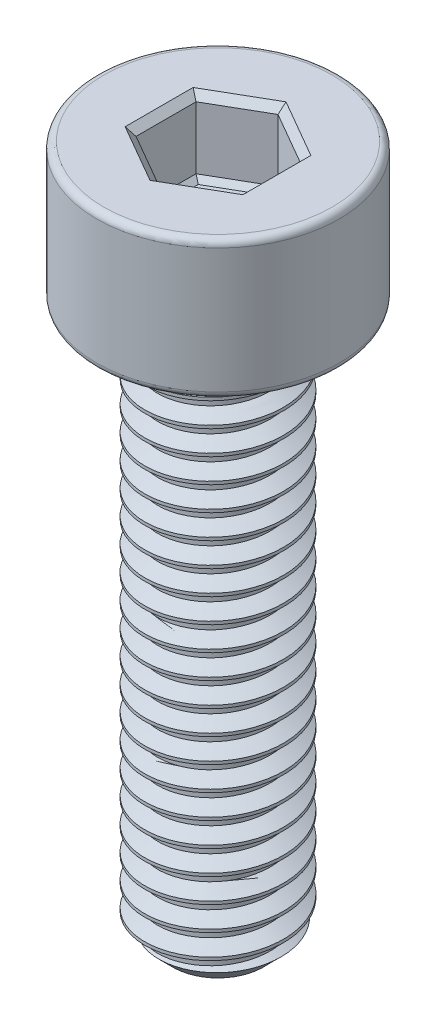
from build123d import *

# Parameters (mm, degrees)
SKETCH1_R           = 2
BOSS_EXTRUDE1_DEPTH = 16
THREAD1_PITCH       = 0.7
SKETCH4_R           = 3.5
BOSS_EXTRUDE2_DEPTH = 4
FILLET1_R           = 0.2
CUT_EXTRUDE1_DEPTH  = 2
CHAMFER1_SIZE       = 0.2
CUT_EXTRUDE2_DEPTH  = 0.15
CUT_EXTRUDE2_DRAFT  = -45


with BuildPart() as part:
    # Sketch1 → Boss-Extrude1 (new body)
    with BuildSketch(Plane(origin=(0, 0, 0), x_dir=(1, 0, 0), z_dir=(0, 1, 0))):
        with Locations(Location((0, 0, 0), (0, 0, 270))):
            Circle(SKETCH1_R)
    extrude(amount=BOSS_EXTRUDE1_DEPTH)

    # Thread1: arcs per turn and ends read off the stored shape
    # Thread1: the profile of Thread Profile1 profile screwed along a right-hand helix through 25.714289 turns, 6 arcs to a turn; built about Z, then put on its axis
    thread1_z = Axis((0, 0, 0), (0, 0, 1))
    thread1_corners = [(2.0003, 0, -0.000173205), (2.0003, 0, 0.612673203), (1.621113887, 0, 0.393749999), (1.621113887, 0, 0.218749999)]
    with BuildLine(mode=Mode.PRIVATE) as thread1_profile:
        Line(thread1_corners[0], thread1_corners[1])
        Line(thread1_corners[1], thread1_corners[2])
        Line(thread1_corners[2], thread1_corners[3])
        Line(thread1_corners[3], thread1_corners[0])
    thread1_cap = Face(thread1_profile.wire())
    thread1_turn_angles = [0, 30, 60, 90, 120, 150, 180, 210, 240, 270, 300, 330, 360]
    thread1_turn_weights = [1, 0.8660254037844387, 1, 0.8660254037844387, 1, 0.8660254037844387, 1, 0.8660254037844387, 1, 0.8660254037844387, 1, 0.8660254037844387, 1]
    thread1_turn_rails = [Edge.make_bspline([Vector(p[0], p[1], 0).rotate(thread1_z, thread1_turn_angles[k]) / thread1_turn_weights[k] + Vector(0, 0, p[2] + THREAD1_PITCH * thread1_turn_angles[k] / 360) for k in range(13)], [0, 0, 0, 1, 1, 2, 2, 3, 3, 4, 4, 5, 5, 6, 6, 6], 2, thread1_turn_weights) for p in thread1_corners]
    thread1_turn_sides = [Face.make_surface_from_curves(thread1_turn_rails[p[0]], thread1_turn_rails[p[1]]) for p in [(0, 1), (1, 2), (2, 3), (3, 0)]]
    thread1_last_angles = [9000, 9030, 9060, 9090, 9120, 9150, 9180, 9210, 9240, 9248.572, 9257.144]
    thread1_last_weights = [1, 0.8660254037844387, 1, 0.8660254037844387, 1, 0.8660254037844387, 1, 0.8660254037844387, 1, 0.9888293397312249, 1]
    thread1_last_rails = [Edge.make_bspline([Vector(p[0], p[1], 0).rotate(thread1_z, thread1_last_angles[k]) / thread1_last_weights[k] + Vector(0, 0, p[2] + THREAD1_PITCH * thread1_last_angles[k] / 360) for k in range(11)], [0, 0, 0, 1, 1, 2, 2, 3, 3, 4, 4, 5, 5, 5], 2, thread1_last_weights) for p in thread1_corners]
    thread1_last_sides = [Face.make_surface_from_curves(thread1_last_rails[p[0]], thread1_last_rails[p[1]]) for p in [(0, 1), (1, 2), (2, 3), (3, 0)]]
    thread1 = Plane(origin=(0, -1, 0), x_dir=(1, 0, 0), z_dir=(0, 1, 0)) * Solid(Shell([*[p.moved(Location((0, 0, THREAD1_PITCH * i))) for i in range(25) for p in thread1_turn_sides], *thread1_last_sides, thread1_cap, thread1_cap.rotate(thread1_z, 9257.144).moved(Location((0, 0, THREAD1_PITCH * 9257.144 / 360)))]))
    add(thread1, mode=Mode.SUBTRACT)

    # Sketch4 → Boss-Extrude2 (add)
    with BuildSketch(Plane(origin=(0, 16, 0), x_dir=(-1, 0, 0), z_dir=(0, -1, 0))):
        with Locations(Location((0, 0, 0), (0, 0, 90))):
            Circle(SKETCH4_R)
    extrude(amount=-BOSS_EXTRUDE2_DEPTH)

    # Fillet1
    fillet1_edges = [part.edges().sort_by_distance(p)[0] for p in [
        (0, 16, 3.5),
        (0, 20, 3.5),
    ]]
    fillet(fillet1_edges, radius=FILLET1_R)

    # Sketch6 → Cut-Revolve1 (revolve, cut)
    with BuildSketch(Plane.XY, mode=Mode.PRIVATE) as cut_revolve1_sk:
        Polygon((2.01, 0), (2.01, 0.7), (1.31, 0), align=None)
    revolve(cut_revolve1_sk.sketch.rotate(Axis((0, 0, 0), (0, 1, 0)), 202.132599438), axis=Axis((0, 0, 0), (0, 1, 0)), mode=Mode.SUBTRACT)

    # Sketch7 → Cut-Extrude1 (cut)
    with BuildSketch(Plane(origin=(0, 20, 0), x_dir=(1, 0, 0), z_dir=(0, 1, 0))):
        Polygon((0, 1.732050808), (-1.5, 0.866025404), (-1.5, -0.866025404), (0, -1.732050808), (1.5, -0.866025404), (1.5, 0.866025404), align=None)
    extrude(amount=-CUT_EXTRUDE1_DEPTH, mode=Mode.SUBTRACT)

    # Chamfer1
    chamfer1_edges = [part.edges().sort_by_distance(p)[0] for p in [
        (0.75, 20, -1.299038106),
        (-0.75, 20, -1.299038106),
        (-1.5, 20, 0),
        (-0.75, 20, 1.299038106),
        (0.75, 20, 1.299038106),
        (1.5, 20, 0),
    ]]
    chamfer(chamfer1_edges, length=CHAMFER1_SIZE)


with BuildPart() as cut_extrude2_tool:
    # Sketch8 → Cut-Extrude2 (with draft: the straight prism first)
    with BuildSketch(Plane(origin=(0, 18, 0), x_dir=(1, 0, 0), z_dir=(0, 1, 0))):
        Polygon((0, 1.732050808), (-1.5, 0.866025404), (-1.5, -0.866025404), (0, -1.732050808), (1.5, -0.866025404), (1.5, 0.866025404), align=None)
    extrude(amount=-CUT_EXTRUDE2_DEPTH)
    # Cut-Extrude2: the draft: its side faces are tilted about the plane it starts from
    cut_extrude2_sides = [cut_extrude2_tool.faces().sort_by_distance(p)[0] for p in [
        (-0.75, 17.925, -1.299038106),
        (-1.5, 17.925, 0),
        (-0.75, 17.925, 1.299038106),
        (0.75, 17.925, 1.299038106),
        (1.5, 17.925, 0),
        (0.75, 17.925, -1.299038106),
    ]]
    draft(cut_extrude2_sides, Plane(origin=(0, 18, 0), x_dir=(1, 0, 0), z_dir=(0, 1, 0)), CUT_EXTRUDE2_DRAFT)


with BuildPart() as part_1:
    add(part.part)

    # Cut-Extrude2: cut by cut_extrude2_tool
    add(cut_extrude2_tool.part, mode=Mode.SUBTRACT)


solid = part_1.part
